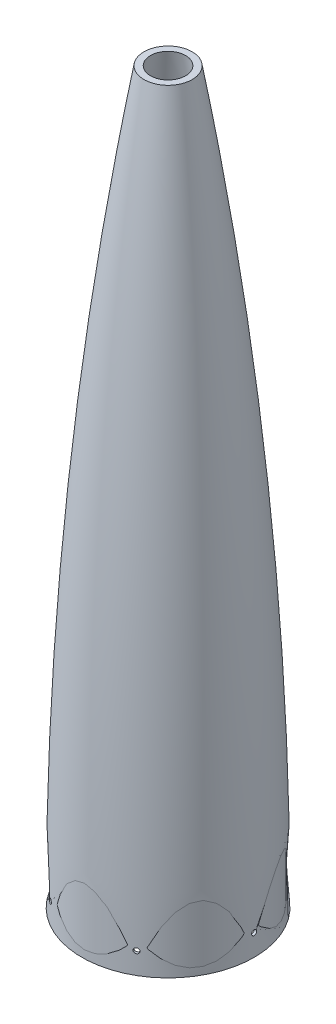
from build123d import *

# Parameters (mm, degrees)
SKETCH4_W          = 83.533222379
SKETCH4_H          = 117.210352631
CUT_EXTRUDE2_DEPTH = 87.376
SKETCH5_R          = 49.53
CUT_EXTRUDE5_DEPTH = 80.01
SKETCH6_R          = 1.524
CUT_EXTRUDE6_DEPTH = 62.484
CIRPATTERN1_COUNT  = 6


# Read off the part's stored shape, not the designer's step: Shell2
with BuildPart() as part:
    # Sketch2 → Revolve1 (revolve)
    with BuildSketch(Plane.XY):
        with BuildLine():
            ThreePointArc((-51.054, 0), (-38.258433103, 255.279509027), (0, 508))
            Line((0, 508), (0, 0))
            Line((0, 0), (-51.054, 0))
        make_face()
    revolve(axis=Axis((0, 0, 0), (0, 1, 0)))

    # Shell2 outline → Shell2 (revolve, cut)
    with BuildSketch(Plane.XY):
        with BuildLine():
            add(Edge.make_bspline(
                [(0, 488.493083776), (47.244, 246.531114188), (47.244, 0)],
                knots=[6.090357515, 6.090357515, 6.090357515, 6.283185307, 6.283185307, 6.283185307], degree=2, weights=[1, 0.99535578, 1]))
            Line((0, 488.493083776), (0, 0))
            Line((0, 0), (47.244, 0))
        make_face()
    revolve(axis=Axis((0, 0, 0), (0, 1, 0)), mode=Mode.SUBTRACT)

    # Sketch4 → Cut-Extrude2 (cut, symmetric)
    with BuildSketch(Plane(origin=(0, 0, 0), x_dir=(0, 0, -1), z_dir=(1, 0, 0))):
        with Locations((-2.96538755, 490.405176316)):
            Rectangle(SKETCH4_W, SKETCH4_H)
    extrude(amount=CUT_EXTRUDE2_DEPTH, both=True, mode=Mode.SUBTRACT)

    # Sketch5 → Cut-Extrude5 (cut)
    with BuildSketch(Plane.XZ):
        with Locations(Location((0, 0, 0), (0, 0, 270))):
            Circle(SKETCH5_R)
    extrude(amount=-CUT_EXTRUDE5_DEPTH, mode=Mode.SUBTRACT)

    # Sketch6 → Cut-Extrude6 (cut)
    with BuildSketch(Plane(origin=(0, 0, 0), x_dir=(0, 0, -1), z_dir=(1, 0, 0))):
        with Locations((0, 12.7)):
            Circle(SKETCH6_R)
    cut_extrude6 = extrude(amount=-CUT_EXTRUDE6_DEPTH, mode=Mode.SUBTRACT)

    # CirPattern1: Cut-Extrude6 ×6 about axis
    cirpattern1_axis = Axis((0, 80.01, 0), (0, -1, 0))
    for i in range(1, CIRPATTERN1_COUNT):
        add(cut_extrude6.rotate(cirpattern1_axis, i * 360 / CIRPATTERN1_COUNT), mode=Mode.SUBTRACT)


solid = part.part
